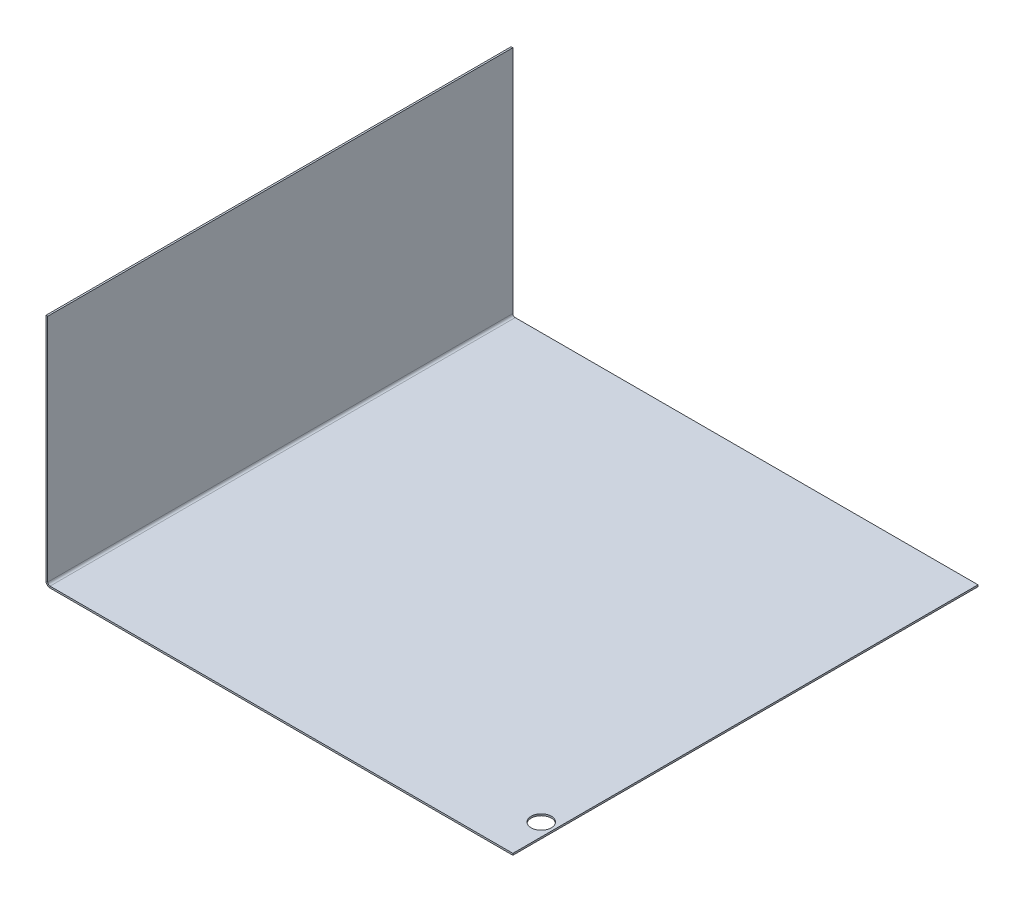
from build123d import *

# Parameters (mm, degrees)
BASE_FLANGE1_DEPTH = 100
SKETCH6_R          = 4.334335372
CUT_EXTRUDE1_DEPTH = 10


# Sheet-metal steps are written as plain solids
with BuildPart() as part:
    # Sketch1 → Base-Flange1 (new, symmetric)
    with BuildSketch(Plane.XY):
        with BuildLine():
            Line((0, 100), (0, 1))
            ThreePointArc((0, 1), (0.292893219, 0.292893219), (1, 0))
            Line((1, 0), (200, 0))
            Line((200, 0), (200, -0.7366))
            Line((200, -0.7366), (1, -0.7366))
            ThreePointArc((1, -0.7366), (-0.227961636, -0.227961636), (-0.7366, 1))
            Line((-0.7366, 1), (-0.7366, 100))
            Line((-0.7366, 100), (0, 100))
        make_face()
    extrude(amount=BASE_FLANGE1_DEPTH, both=True)

    # Sketch6 → Cut-Extrude1 (cut)
    with BuildSketch(Plane(origin=(0, 0, 0), x_dir=(1, 0, 0), z_dir=(0, 1, 0))):
        with Locations(Location((194.445286262, -82.216924087, 0), (0, 0, 270))):
            Circle(SKETCH6_R)
    extrude(amount=-CUT_EXTRUDE1_DEPTH, mode=Mode.SUBTRACT)


solid = part.part
